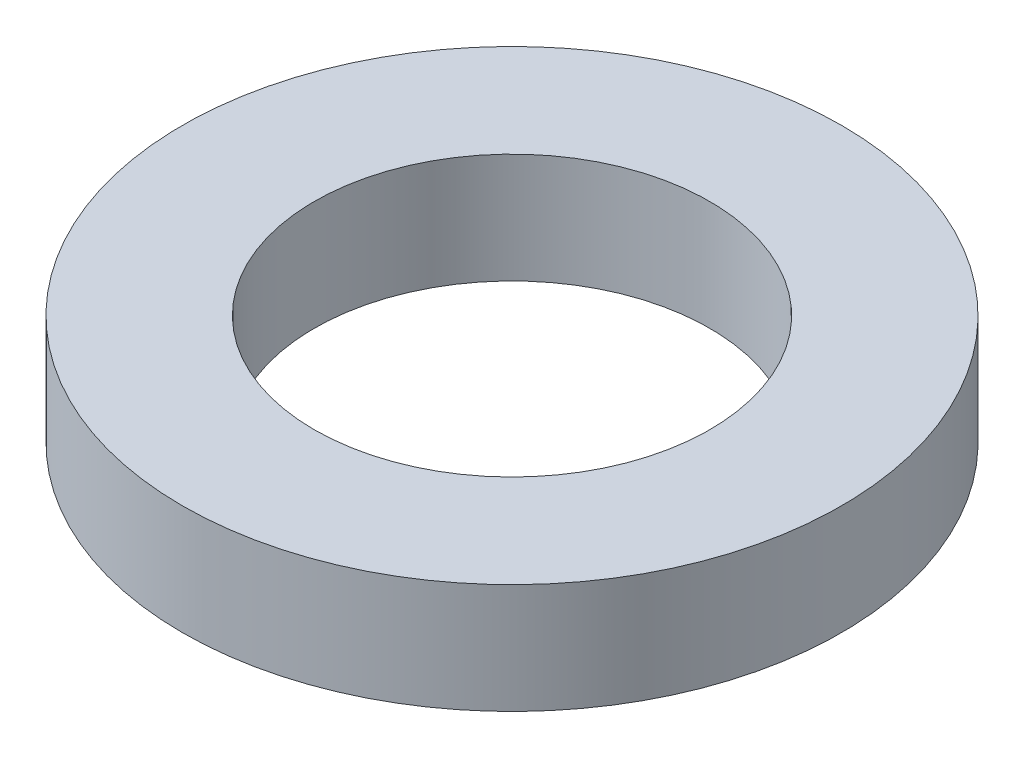
from build123d import *

# Parameters (mm, degrees)
SKETCH1_R           = 75
BOSS_EXTRUDE1_DEPTH = 25
SKETCH2_R           = 45
CUT_EXTRUDE1_DEPTH  = 109.972473589


with BuildPart() as part:
    # Sketch1 → Boss-Extrude1 (new body)
    with BuildSketch(Plane(origin=(0, 0, 0), x_dir=(1, 0, 0), z_dir=(0, 1, 0))):
        Circle(SKETCH1_R)
    extrude(amount=BOSS_EXTRUDE1_DEPTH)

    # Sketch2 → Cut-Extrude1 (cut, through all)
    with BuildSketch(Plane(origin=(0, 0, 0), x_dir=(1, 0, 0), z_dir=(0, 1, 0))):
        Circle(SKETCH2_R)
    extrude(amount=CUT_EXTRUDE1_DEPTH, mode=Mode.SUBTRACT)


solid = part.part
